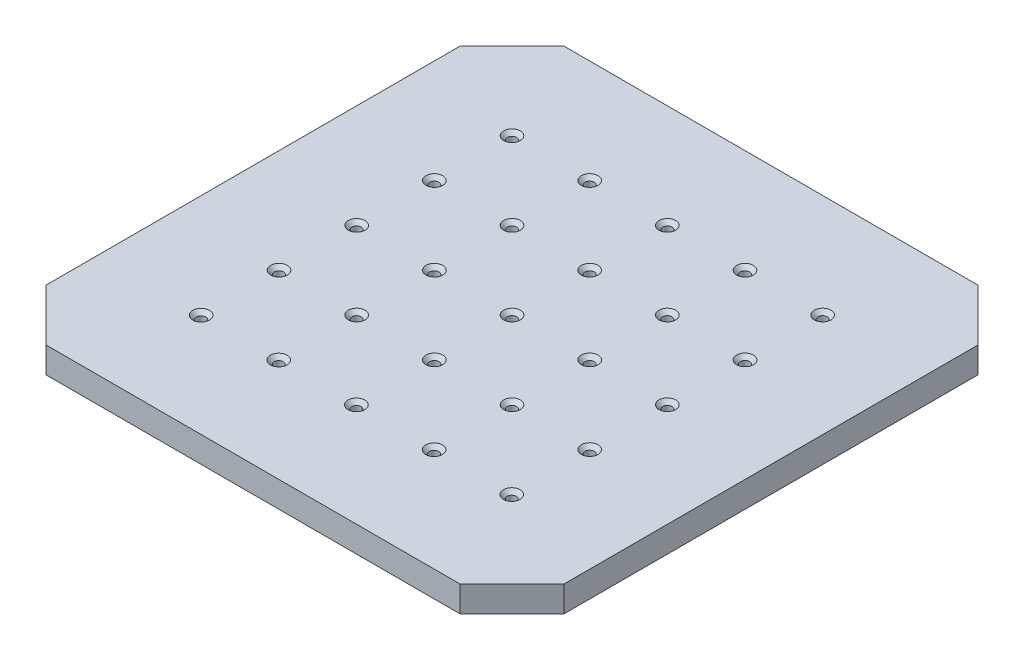
from build123d import *

# Parameters (mm, degrees)
SKETCH1_W                       = 127
SKETCH1_H                       = 127
BOSS_EXTRUDE1_DEPTH             = 6.35
F_4_40_TAPPED_HOLE2_D           = 2.2606
F_4_40_TAPPED_HOLE2_CSINK_D     = 4.1148
F_4_40_TAPPED_HOLE2_CSINK_ANGLE = 90
CHAMFER3_SIZE                   = 12.7
CHAMFER4_SIZE                   = 12.7
CHAMFER5_SIZE                   = 12.7
CHAMFER6_SIZE                   = 12.7


with BuildPart() as part:
    # Sketch1 → Boss-Extrude1 (new body)
    with BuildSketch(Plane(origin=(0, 0, 0), x_dir=(1, 0, 0), z_dir=(0, 1, 0))):
        Rectangle(SKETCH1_W, SKETCH1_H)
    extrude(amount=BOSS_EXTRUDE1_DEPTH)

    # #4-40 Tapped Hole2 (through all)
    with Locations(Plane(origin=(0, 6.35, 0), x_dir=(1, 0, 0), z_dir=(0, 1, 0))):
        with Locations((19.05, 0), (0, 0), (0, -19.05), (-19.05, -19.05), (-38.1, -19.05), (-38.1, -38.161278206), (-19.05, -38.161278206), (0, -38.161278206), (19.05, -38.161278206), (19.05, -19.05), (38.1, -19.05), (38.1, -38.161278206), (38.1, 0), (-19.05, 0), (-38.1, 0), (-38.1, 19.05), (-19.05, 19.05), (0, 19.05), (19.05, 19.05), (38.1, 19.05), (0, 38.1), (19.05, 38.1), (38.1, 38.1), (-19.05, 38.1), (-38.1, 38.1)):
            CounterSinkHole(F_4_40_TAPPED_HOLE2_D / 2, F_4_40_TAPPED_HOLE2_CSINK_D / 2, counter_sink_angle=F_4_40_TAPPED_HOLE2_CSINK_ANGLE)

    # Chamfer3
    chamfer3_edges = [part.edges().sort_by_distance(p)[0] for p in [
        (-63.5, 3.175, 63.5),
    ]]
    chamfer(chamfer3_edges, length=CHAMFER3_SIZE)

    # Chamfer4
    chamfer4_edges = [part.edges().sort_by_distance(p)[0] for p in [
        (63.5, 3.175, 63.5),
    ]]
    chamfer(chamfer4_edges, length=CHAMFER4_SIZE)

    # Chamfer5
    chamfer5_edges = [part.edges().sort_by_distance(p)[0] for p in [
        (63.5, 3.175, -63.5),
    ]]
    chamfer(chamfer5_edges, length=CHAMFER5_SIZE)

    # Chamfer6
    chamfer6_edges = [part.edges().sort_by_distance(p)[0] for p in [
        (-63.5, 3.175, -63.5),
    ]]
    chamfer(chamfer6_edges, length=CHAMFER6_SIZE)


solid = part.part
